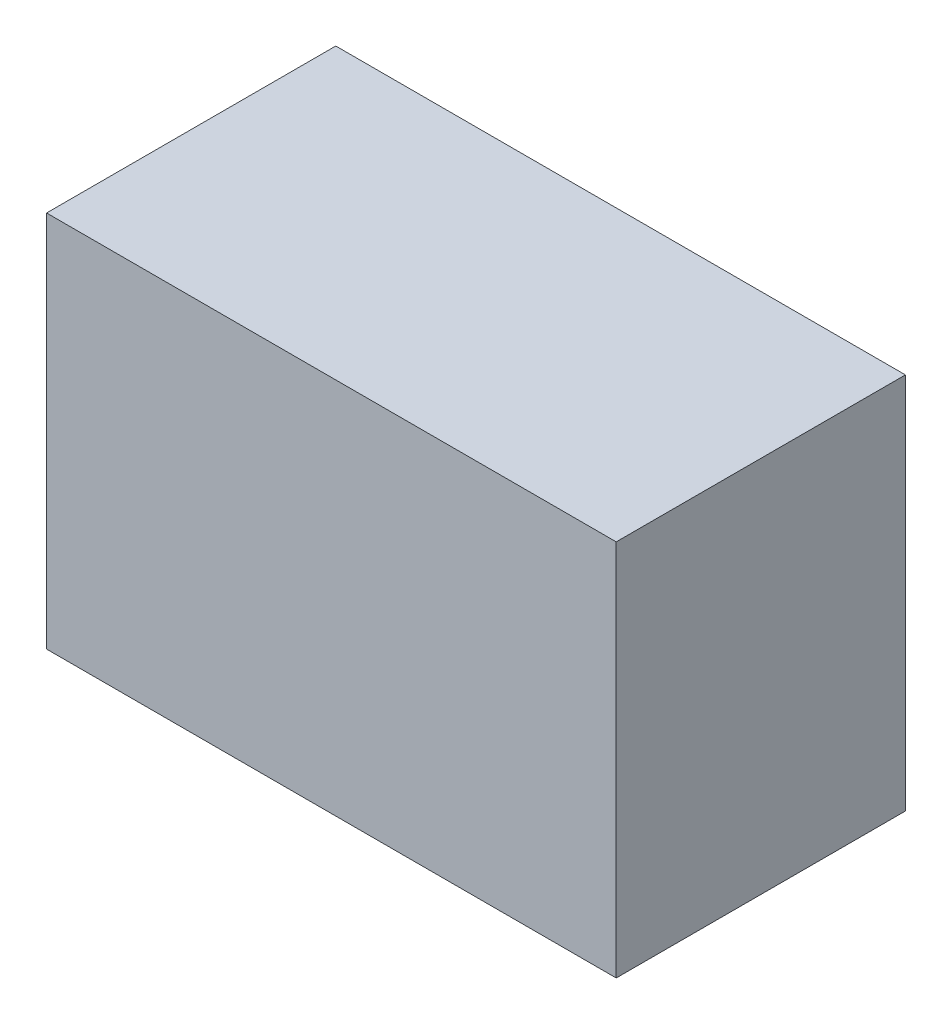
from build123d import *

# Parameters (mm, degrees)
SKETCH1_W           = 165.1
SKETCH1_H           = 83.82
BOSS_EXTRUDE1_DEPTH = 109.474


with BuildPart() as part:
    # Sketch1 → Boss-Extrude1 (new body)
    with BuildSketch(Plane(origin=(0, 0, 0), x_dir=(1, 0, 0), z_dir=(0, 1, 0))):
        Rectangle(SKETCH1_W, SKETCH1_H)
    extrude(amount=BOSS_EXTRUDE1_DEPTH)


solid = part.part
